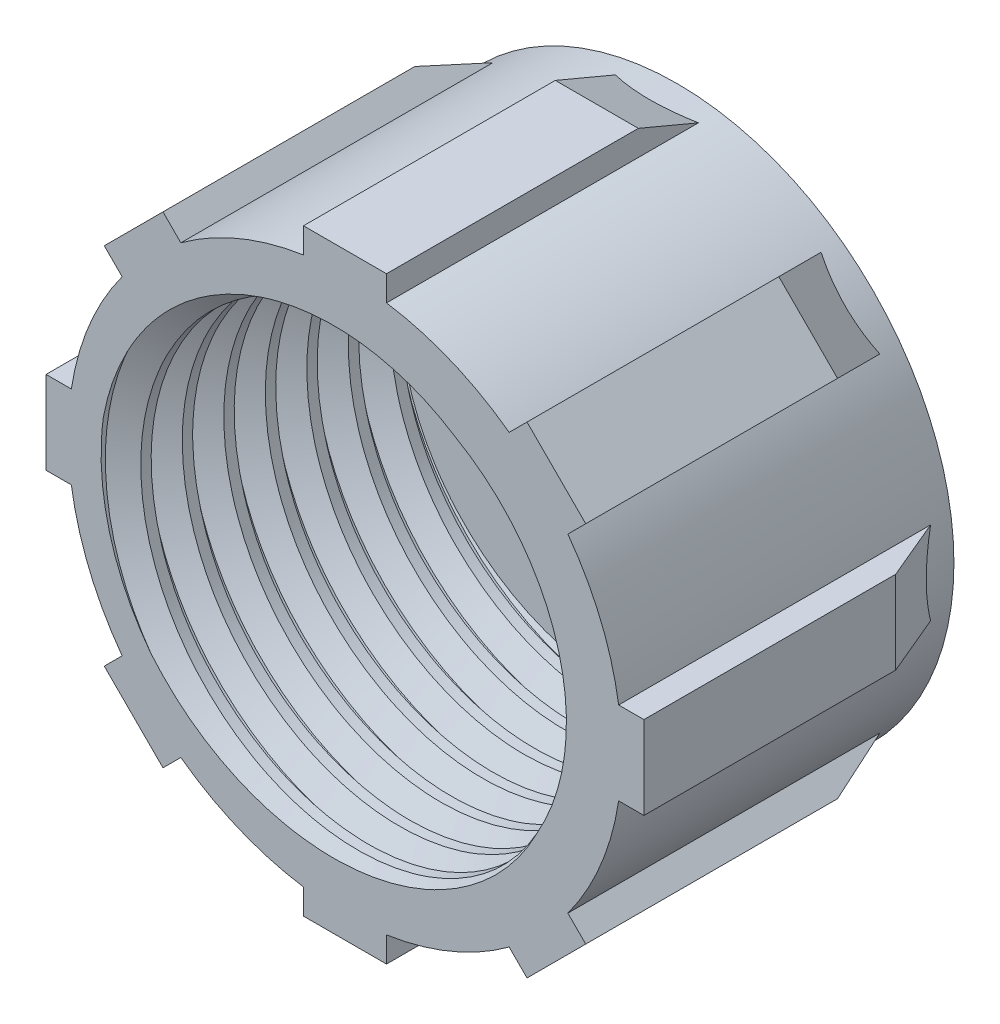
from build123d import *

# Parameters (mm, degrees)
SKETCH1_R           = 10
BOSS_EXTRUDE1_DEPTH = 12
SKETCH2_R           = 8
CUT_EXTRUDE1_DEPTH  = 10
THREAD1_PITCH       = 1.5
BOSS_EXTRUDE2_DEPTH = 1.5
CIRPATTERN1_COUNT   = 8


with BuildPart() as part:
    # Sketch1 → Boss-Extrude1 (new body)
    with BuildSketch(Plane.XY):
        Circle(SKETCH1_R)
    extrude(amount=BOSS_EXTRUDE1_DEPTH)

    # Sketch2 → Cut-Extrude1 (cut)
    with BuildSketch(Plane.XY.offset(12)):
        Circle(SKETCH2_R)
    extrude(amount=-CUT_EXTRUDE1_DEPTH, mode=Mode.SUBTRACT)

    # Thread1: the profile of Thread Profile1 profile screwed along a right-hand helix of 10 turns, 8 arcs to a turn; built about Z, then put on its axis
    thread1_z = Axis((0, 0, 0), (0, 0, 1))
    thread1_corners = [(7.9997, 0, -0.000173205), (8.811898813, 0, 0.468749998), (8.811898813, 0, 0.656249998), (7.9997, 0, 1.125173201)]
    with BuildLine(mode=Mode.PRIVATE) as thread1_profile:
        Line(thread1_corners[0], thread1_corners[1])
        Line(thread1_corners[1], thread1_corners[2])
        Line(thread1_corners[2], thread1_corners[3])
        Line(thread1_corners[3], thread1_corners[0])
    thread1_cap = Face(thread1_profile.wire())
    thread1_turn_angles = [0, 22.5, 45, 67.5, 90, 112.5, 135, 157.5, 180, 202.5, 225, 247.5, 270, 292.5, 315, 337.5, 360]
    thread1_turn_weights = [1, 0.9238795325112867, 1, 0.9238795325112867, 1, 0.9238795325112867, 1, 0.9238795325112867, 1, 0.9238795325112867, 1, 0.9238795325112867, 1, 0.9238795325112867, 1, 0.9238795325112867, 1]
    thread1_turn_rails = [Edge.make_bspline([Vector(p[0], p[1], 0).rotate(thread1_z, thread1_turn_angles[k]) / thread1_turn_weights[k] + Vector(0, 0, p[2] + THREAD1_PITCH * thread1_turn_angles[k] / 360) for k in range(17)], [0, 0, 0, 1, 1, 2, 2, 3, 3, 4, 4, 5, 5, 6, 6, 7, 7, 8, 8, 8], 2, thread1_turn_weights) for p in thread1_corners]
    thread1_turn_sides = [Face.make_surface_from_curves(thread1_turn_rails[p[0]], thread1_turn_rails[p[1]]) for p in [(0, 1), (1, 2), (2, 3), (3, 0)]]
    thread1 = Plane(origin=(0, 0, 17), x_dir=(-1, 0, 0), z_dir=(0, 0, -1)) * Solid(Shell([*[p.moved(Location((0, 0, THREAD1_PITCH * i))) for i in range(10) for p in thread1_turn_sides], thread1_cap, thread1_cap.rotate(thread1_z, 3600).moved(Location((0, 0, THREAD1_PITCH * 3600 / 360)))]))
    add(thread1, mode=Mode.SUBTRACT)

    # Sketch6 → Boss-Extrude2 (add, symmetric)
    with BuildSketch(Plane(origin=(0, 0, 0), x_dir=(0, 0, -1), z_dir=(1, 0, 0))):
        Polygon((-2.902640689, 10.8), (-12, 10.8), (-12, 10), (-1, 10), align=None)
        Polygon((-12, 9.637875341), (-12, 10), (-1, 10), (-0.138758611, 9.637875341), align=None)
    boss_extrude2 = extrude(amount=BOSS_EXTRUDE2_DEPTH, both=True)

    # CirPattern1: Boss-Extrude2 ×8 about axis
    cirpattern1_axis = Axis((0, 0, 0), (0, 0, 1))
    for i in range(1, CIRPATTERN1_COUNT):
        add(boss_extrude2.rotate(cirpattern1_axis, i * 360 / CIRPATTERN1_COUNT))


solid = part.part
